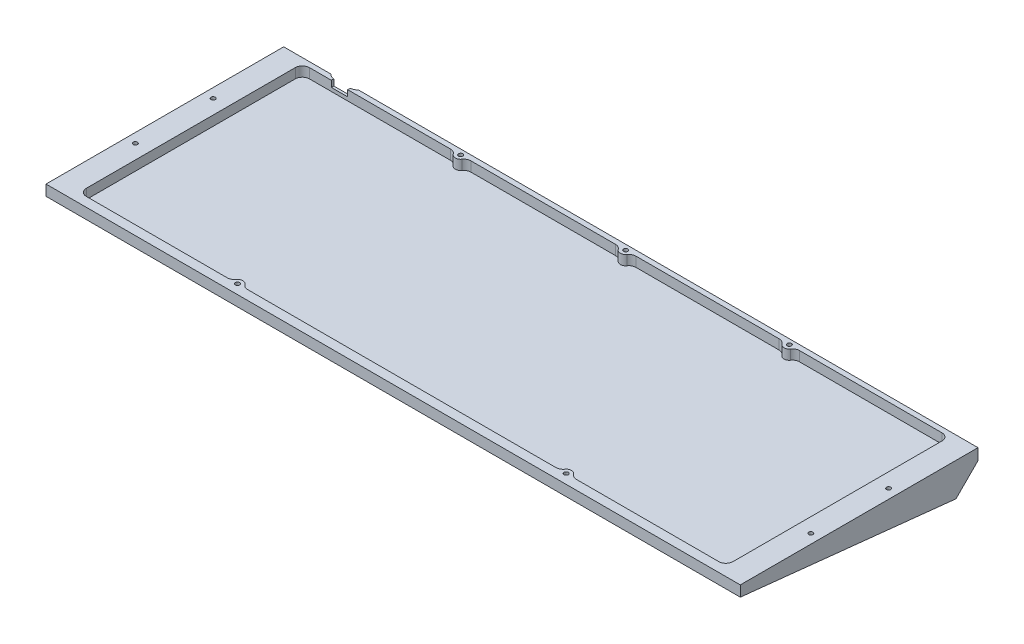
from build123d import *

# Parameters (mm, degrees)
SKETCH1_W               = 390.8
SKETCH1_H               = 133.8
BOSS_EXTRUDE1_DEPTH     = 6
SKETCH2_W               = 364
SKETCH2_H               = 125.6
CUT_EXTRUDE1_DEPTH      = 5.5
BOSS_EXTRUDE3_DEPTH     = 390.8
SKETCH8_W               = 9.2
SKETCH8_H               = 3.5
CUT_EXTRUDE2_DEPTH      = 10
BOSS_EXTRUDE4_DEPTH     = 5.5
SKETCH11_W              = 15.2
SKETCH11_H              = 5.5
CUT_EXTRUDE3_DEPTH      = 1.5
CUT_EXTRUDE6_DEPTH      = 414.309625425
CUT_EXTRUDE6_DEPTH_BACK = 414.309625425
FILLET1_R               = 4
M2_CLEARANCE_HOLE1_D    = 2.4
CUT_EXTRUDE7_START      = -3
SKETCH13_R              = 2.5
CUT_EXTRUDE7_DEPTH      = 411.496043655
FILLET2_R               = 4


with BuildPart() as part:
    # Sketch1 → Boss-Extrude1 (new body)
    with BuildSketch(Plane(origin=(0, 0, 0), x_dir=(1, 0, 0), z_dir=(0, 1, 0))):
        with Locations((195.4, 66.9)):
            Rectangle(SKETCH1_W, SKETCH1_H)
    extrude(amount=BOSS_EXTRUDE1_DEPTH)

    # Sketch2 → Cut-Extrude1 (cut)
    with BuildSketch(Plane(origin=(0, 6, 0), x_dir=(1, 0, 0), z_dir=(0, 1, 0))):
        with Locations((195.4, 68.1)):
            Rectangle(SKETCH2_W, SKETCH2_H)
    extrude(amount=-CUT_EXTRUDE1_DEPTH, mode=Mode.SUBTRACT)

    # Boss-Extrude3: read off the stored shape, not the designer's step
    # Boss-Extrude3 outline → Boss-Extrude3 (add)
    with BuildSketch(Plane.YZ):
        Polygon((-14.062946679, -133.8), (0, -133.8), (0, 0), align=None)
    extrude(amount=BOSS_EXTRUDE3_DEPTH)

    # Sketch8 → Cut-Extrude2 (cut)
    with BuildSketch(Plane(origin=(0, 0, -133.8), x_dir=(-1, 0, 0), z_dir=(0, 0, -1))):
        with Locations((-34.3, 4.25)):
            Rectangle(SKETCH8_W, SKETCH8_H)
    extrude(amount=-CUT_EXTRUDE2_DEPTH, mode=Mode.SUBTRACT)

    # Sketch10 → Boss-Extrude4 (add)
    with BuildSketch(Plane(origin=(0, 0.5, 0), x_dir=(1, 0, 0), z_dir=(0, 1, 0))):
        with BuildLine():
            Line((99.5, 5.3), (105.5, 5.3))
            ThreePointArc((105.5, 5.3), (102.5, 8.3), (99.5, 5.3))
        make_face()
        with BuildLine():
            ThreePointArc((290.5, 5.3), (287.5, 8.3), (284.5, 5.3))
            Line((284.5, 5.3), (290.5, 5.3))
        make_face()
        with BuildLine():
            Line((105.5, 130.9), (99.5, 130.9))
            ThreePointArc((99.5, 130.9), (102.5, 127.9), (105.5, 130.9))
        make_face()
        with BuildLine():
            ThreePointArc((284.5, 130.9), (287.5, 127.9), (290.5, 130.9))
            Line((290.5, 130.9), (284.5, 130.9))
        make_face()
        with BuildLine():
            Line((198.4, 130.9), (192.4, 130.9))
            ThreePointArc((192.4, 130.9), (195.4, 127.9), (198.4, 130.9))
        make_face()
    extrude(amount=BOSS_EXTRUDE4_DEPTH)

    # Sketch11 → Cut-Extrude3 (cut)
    with BuildSketch(Plane(origin=(0, 0, -133.8), x_dir=(-1, 0, 0), z_dir=(0, 0, -1))):
        with Locations((-34.3, 3.25)):
            Rectangle(SKETCH11_W, SKETCH11_H)
    extrude(amount=-CUT_EXTRUDE3_DEPTH, mode=Mode.SUBTRACT)

    # Sketch12 → Cut-Extrude6 (cut, two sides: drawn at the far end of the back side and taken through both)
    with BuildSketch(Plane.ZY.offset(-CUT_EXTRUDE6_DEPTH_BACK)):
        Polygon((-133.8, -14.062946679), (-121.393278428, -12.758947696), (-133.8, -0.352226124), align=None)
    extrude(amount=CUT_EXTRUDE6_DEPTH + CUT_EXTRUDE6_DEPTH_BACK, mode=Mode.SUBTRACT)

    # Fillet1
    fillet1_edges = [part.edges().sort_by_distance(p)[0] for p in [
        (13.4, 3.25, -5.3),
        (13.4, 3.25, -130.9),
        (377.4, 3.25, -130.9),
        (377.4, 3.25, -5.3),
        (99.5, 3.25, -130.9),
        (105.5, 3.25, -130.9),
        (192.4, 3.25, -130.9),
        (198.4, 3.25, -130.9),
        (284.5, 3.25, -130.9),
        (290.5, 3.25, -130.9),
        (290.5, 3.25, -5.3),
        (284.5, 3.25, -5.3),
        (105.5, 3.25, -5.3),
        (99.5, 3.25, -5.3),
    ]]
    fillet(fillet1_edges, radius=FILLET1_R)

    # M2 Clearance Hole1 (through all)
    with Locations(Plane(origin=(102.5, 6, -5.3), x_dir=(0, 0, 1), z_dir=(0, 1, 0))):
        with Locations((0, 0), (-39.7, -97.2), (-83.5, -97.2), (-125.6, 0), (-125.6, 92.9), (-125.6, 185), (-83.5, 283), (-39.7, 283), (0, 185)):
            Hole(M2_CLEARANCE_HOLE1_D / 2)

    # Sketch13 → Cut-Extrude7 (cut, through all)
    with BuildSketch(Plane(origin=(0, 6, 0), x_dir=(1, 0, 0), z_dir=(0, 1, 0)).offset(CUT_EXTRUDE7_START)):
        with Locations(Location((5.3, 45, 0), (0, 0, 270))):
            Circle(SKETCH13_R)
        with Locations(Location((5.3, 88.8, 0), (0, 0, 270))):
            Circle(SKETCH13_R)
        with Locations(Location((102.5, 5.3, 0), (0, 0, 270))):
            Circle(SKETCH13_R)
        with Locations(Location((287.5, 5.3, 0), (0, 0, 270))):
            Circle(SKETCH13_R)
        with Locations(Location((385.5, 45, 0), (0, 0, 270))):
            Circle(SKETCH13_R)
        with Locations(Location((385.5, 88.8, 0), (0, 0, 270))):
            Circle(SKETCH13_R)
        with Locations(Location((287.5, 130.9, 0), (0, 0, 270))):
            Circle(SKETCH13_R)
        with Locations(Location((195.4, 130.9, 0), (0, 0, 270))):
            Circle(SKETCH13_R)
        with Locations(Location((102.5, 130.9, 0), (0, 0, 270))):
            Circle(SKETCH13_R)
    extrude(amount=-CUT_EXTRUDE7_DEPTH, mode=Mode.SUBTRACT)

    # Fillet2
    # the kernel refuses this fillet: 4 mm, written as the material it adds along each edge
    with BuildSketch(Plane(origin=(41.9, -7.306247498, -132.3), x_dir=(-1, 0, 0), z_dir=(0, 1, 0))) as fillet2_piece_1_section:
        with BuildLine():
            CenterArc((3.122498999, -4), FILLET2_R, 90, 51.317812547)
            Line((0, -1.5), (0, 0))
            Line((0, 0), (3.122498999, 0))
        make_face()
    fillet2_piece_1 = extrude(amount=21.112494996, mode=Mode.PRIVATE)
    fillet2_piece_1 = split(fillet2_piece_1, bisect_by=Plane(origin=(41.9, 2.5, -132.3), z_dir=(0, -1, 0)), keep=Keep.TOP, mode=Mode.PRIVATE)
    fillet2_piece_1 = split(fillet2_piece_1, bisect_by=Plane(origin=(41.9, -4.579236811, -129.572989313), z_dir=(0, 0.7071067811865451, 0.70710678118655)), keep=Keep.TOP, mode=Mode.PRIVATE)
    add(fillet2_piece_1)
    with BuildSketch(Plane(origin=(41.9, -7.306247498, -132.3), x_dir=(-1, 0, 0), z_dir=(0, 1, 0))) as fillet2_piece_2_section:
        with BuildLine():
            CenterArc((3.122498999, -4), FILLET2_R, 90, 51.317812547)
            Line((0, -1.5), (0, 0))
            Line((0, 0), (3.122498999, 0))
        make_face()
    fillet2_piece_2 = extrude(amount=13.306247498, mode=Mode.PRIVATE)
    fillet2_piece_2 = split(fillet2_piece_2, bisect_by=Plane(origin=(38.9, -7.306247498, -132.3), z_dir=(1, 0, 0)), keep=Keep.TOP, mode=Mode.PRIVATE)
    fillet2_piece_2 = split(fillet2_piece_2, bisect_by=Plane(origin=(41.9, -4.579236811, -129.572989313), z_dir=(0, 0.7071067811865451, 0.70710678118655)), keep=Keep.TOP, mode=Mode.PRIVATE)
    add(fillet2_piece_2)
    with BuildSketch(Plane(origin=(26.7, 6, -132.3), x_dir=(1, 0, 0), z_dir=(0, -1, 0))) as fillet2_piece_3_section:
        with BuildLine():
            CenterArc((3.122498999, -4), FILLET2_R, 90, 51.317812547)
            Line((0, -1.5), (0, 0))
            Line((0, 0), (3.122498999, 0))
        make_face()
    fillet2_piece_3 = extrude(amount=13.306247498, mode=Mode.PRIVATE)
    fillet2_piece_3 = split(fillet2_piece_3, bisect_by=Plane(origin=(29.7, 6, -132.3), z_dir=(-1, 0, 0)), keep=Keep.TOP, mode=Mode.PRIVATE)
    fillet2_piece_3 = split(fillet2_piece_3, bisect_by=Plane(origin=(26.7, 2.073886938, -136.226113062), z_dir=(0, 0.7071067811865451, 0.70710678118655)), keep=Keep.TOP, mode=Mode.PRIVATE)
    add(fillet2_piece_3)
    with BuildSketch(Plane(origin=(26.7, 13.806247498, -132.3), x_dir=(1, 0, 0), z_dir=(0, -1, 0))) as fillet2_piece_4_section:
        with BuildLine():
            CenterArc((3.122498999, -4), FILLET2_R, 90, 51.317812547)
            Line((0, -1.5), (0, 0))
            Line((0, 0), (3.122498999, 0))
        make_face()
    fillet2_piece_4 = extrude(amount=21.112494996, mode=Mode.PRIVATE)
    fillet2_piece_4 = split(fillet2_piece_4, bisect_by=Plane(origin=(26.7, 2.5, -132.3), z_dir=(0, -1, 0)), keep=Keep.TOP, mode=Mode.PRIVATE)
    fillet2_piece_4 = split(fillet2_piece_4, bisect_by=Plane(origin=(26.7, 5.977010687, -140.129236811), z_dir=(0, 0.7071067811865451, 0.70710678118655)), keep=Keep.TOP, mode=Mode.PRIVATE)
    add(fillet2_piece_4)


solid = part.part
